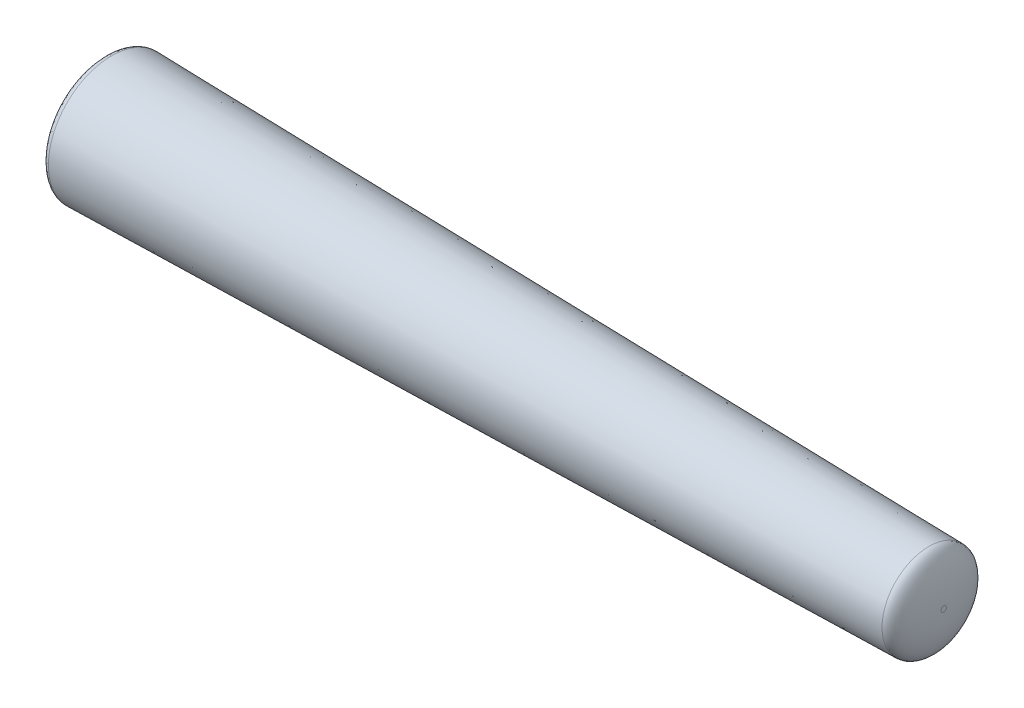
from build123d import *

# Parameters (mm, degrees)
SKETCH1_R                     = 3.5
BOSS_EXTRUDE1_DEPTH           = 27
BOSS_EXTRUDE1_TAPER           = 1.15
BOSS_EXTRUDE1_OTHER_WAY_DEPTH = 27
BOSS_EXTRUDE1_OTHER_WAY_TAPER = -1.15


with BuildPart() as part:
    # Sketch1 → Boss-Extrude1 (new body)
    with BuildSketch(Plane(origin=(0, 0, 0), x_dir=(0, 0, -1), z_dir=(1, 0, 0))):
        Circle(SKETCH1_R)
    extrude(amount=BOSS_EXTRUDE1_DEPTH, taper=BOSS_EXTRUDE1_TAPER)

    # Sketch1 → Boss-Extrude1 other way (add)
    with BuildSketch(Plane(origin=(0, 0, 0), x_dir=(0, 0, -1), z_dir=(1, 0, 0))):
        Circle(SKETCH1_R)
    extrude(amount=-BOSS_EXTRUDE1_OTHER_WAY_DEPTH, taper=BOSS_EXTRUDE1_OTHER_WAY_TAPER)

    # Fillet1
    # an asymmetric fillet: 3.7, 1 mm, written as the material it takes off along each edge
    with BuildSketch(Plane(origin=(-27, 0, 0), x_dir=(0, 0, -1), z_dir=(0, -1, 0))) as fillet1_piece_1:
        with BuildLine():
            Bezier((4.020432866, 1.074258773), (4.041997517, 0), (0.321178125, 0), weights=[1, 0.699975021, 1])
            Line((0.321178125, 0), (4.041997517, 0))
            Line((4.041997517, 0), (4.020432866, 1.074258773))
        make_face()
    revolve(axis=Axis((-27, 0, 0), (1, 0, 0)), mode=Mode.SUBTRACT)

    # Fillet2
    # an asymmetric fillet: 2.8, 1 mm, written as the material it takes off along each edge
    with BuildSketch(Plane(origin=(27, 0, 0), x_dir=(0, 0, -1), z_dir=(0, 1, 0))) as fillet2_piece_1:
        with BuildLine():
            Bezier((2.976948391, 0.943804171), (2.958002483, 0), (0.177512371, 0), weights=[1, 0.714167326, 1])
            Line((0.177512371, 0), (2.958002483, 0))
            Line((2.958002483, 0), (2.976948391, 0.943804171))
        make_face()
    revolve(axis=Axis((27, 0, 0), (-1, 0, 0)), mode=Mode.SUBTRACT)


solid = part.part
